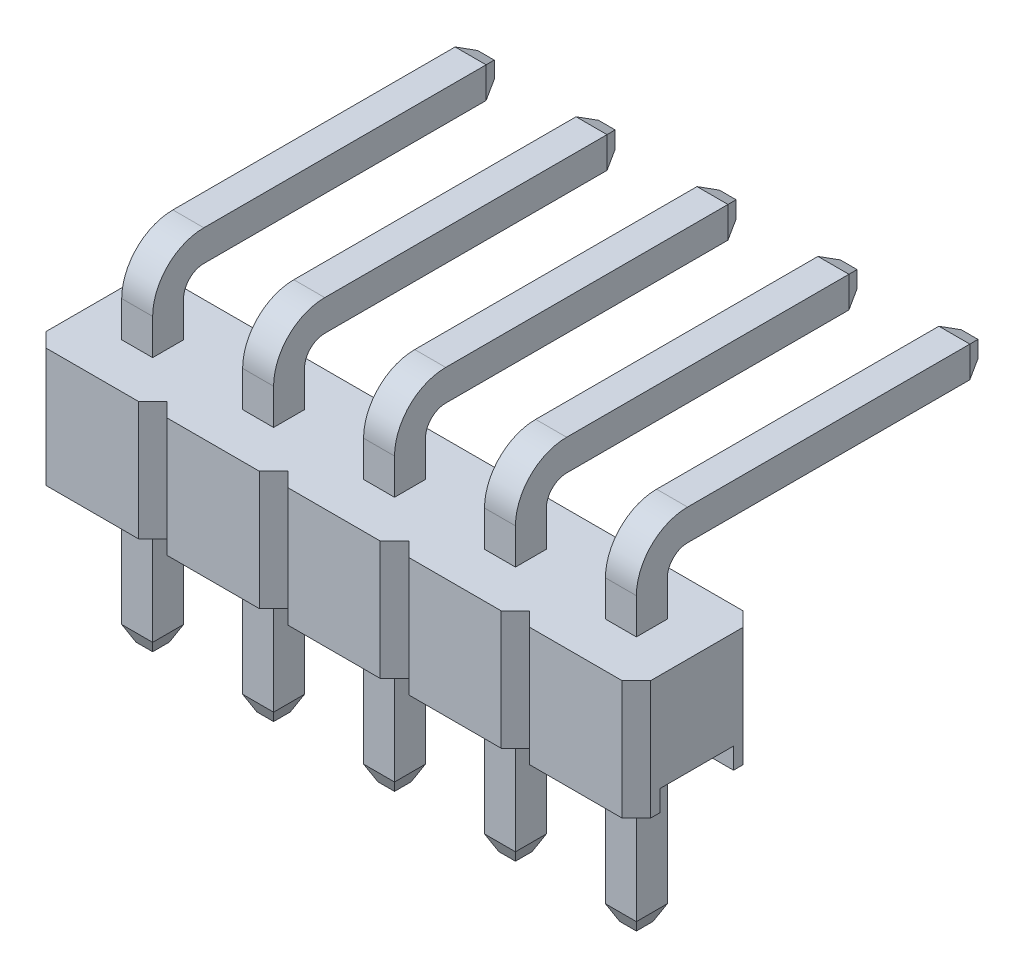
from build123d import *

# Parameters (mm, degrees)
BASE_DEPTH          = 2.5
BASE_PATTERN_COUNT  = 5
BASE_PATTERN_PITCH  = 2.54
CUT_DEPTH           = 12.768933682
CUT_DEPTH_BACK      = 12.768933682
SKETCH2_W           = 1.54
SKETCH2_H           = 0.44
SKETCH3_W           = 0.65
SKETCH3_H           = 0.65
PIN_CHAMFER_SIZE    = 0.15
PIN_CHAMFER_SIZE2   = 0.321676038
CHAMFER1_SIZE       = 0.15
CHAMFER1_SIZE2      = 0.321676038
PIN_START           = 2.215
PIN_PATTERN_DEPTH   = 0.65
PIN_START_2         = 4.755
PIN_PATTERN_2_DEPTH = 0.65
PIN_START_3         = 7.295
PIN_PATTERN_3_DEPTH = 0.65
PIN_START_4         = 9.835
PIN_PATTERN_4_DEPTH = 0.65
PIN_START_5         = -6.678323962
PIN_PATTERN_5_DEPTH = 7.678323962
PIN_START_6         = 2.5
PIN_PATTERN_6_DEPTH = 2.5


with BuildPart() as part:
    # Sketch1 → Base (new body)
    with BuildSketch(Plane(origin=(0, 0, 0), x_dir=(1, 0, 0), z_dir=(0, 1, 0))):
        Polygon((-1.27, 0.97), (-0.97, 1.27), (0.97, 1.27), (1.27, 0.97), (1.27, -0.97), (0.97, -1.27), (-0.97, -1.27), (-1.27, -0.97), align=None)
    base = extrude(amount=BASE_DEPTH)

    # Base_Pattern: Base ×5
    with Locations(*[(i * BASE_PATTERN_PITCH, 0, 0) for i in range(1, BASE_PATTERN_COUNT)]):
        add(base)

    # Sketch2 → Cut (cut, two sides: drawn at the far end of the back side and taken through both)
    with BuildSketch(Plane(origin=(0, 0, 0), x_dir=(0, 0, -1), z_dir=(1, 0, 0)).offset(-CUT_DEPTH_BACK)):
        with Locations((0, 0.22)):
            Rectangle(SKETCH2_W, SKETCH2_H)
    extrude(amount=CUT_DEPTH + CUT_DEPTH_BACK, mode=Mode.SUBTRACT)

    # Sweep1: sweep along a path in Sketch4
    with BuildLine(Plane(origin=(0, 0, 0), x_dir=(0, 0, -1), z_dir=(1, 0, 0))) as sweep1_path:
        Line((0, -3), (0, 3.25))
        ThreePointArc((0, 3.25), (0.219669914, 3.780330086), (0.75, 4))
        Line((0.75, 4), (7, 4))
    # Sketch3 → Sweep1 (sweep)
    with BuildSketch(Plane(origin=(0, -3, 0), x_dir=(1, 0, 0), z_dir=(0, 1, 0))):
        Rectangle(SKETCH3_W, SKETCH3_H)
    sweep(path=sweep1_path.line)

    # Pin Chamfer
    pin_chamfer_edges = [part.edges().sort_by_distance(p)[0] for p in [
        (0.325, -3, 0),
        (0, -3, -0.325),
        (-0.325, -3, 0),
        (0, -3, 0.325),
    ]]
    pin_chamfer_side = [part.faces().sort_by_distance(p)[0] for p in [
        (0, -3, 0),
    ]]
    chamfer(pin_chamfer_edges, length=PIN_CHAMFER_SIZE, length2=PIN_CHAMFER_SIZE2, reference=pin_chamfer_side[0])

    # Chamfer1
    chamfer1_edges = [part.edges().sort_by_distance(p)[0] for p in [
        (-0.325, 4, -7),
        (0, 4.325, -7),
        (0.325, 4, -7),
        (0, 3.675, -7),
    ]]
    chamfer1_side = [part.faces().sort_by_distance(p)[0] for p in [
        (0, 4, -7),
    ]]
    chamfer(chamfer1_edges, length=CHAMFER1_SIZE, length2=CHAMFER1_SIZE2, reference=chamfer1_side[0])

    # Pin Pattern: read off the stored shape, not the designer's step
    # Pin Pattern outline → Pin Pattern (add)
    with BuildSketch(Plane.YZ.offset(PIN_START)):
        Polygon((-2.678323962, 0.325), (-3, 0.175), (-3, -0.175), (-2.678323962, -0.325), (0.44, -0.325), (0.44, 0.325), align=None)
        with BuildLine():
            Line((2.5, -0.325), (3.25, -0.325))
            ThreePointArc((3.25, -0.325), (3.550520382, -0.449479618), (3.675, -0.75))
            Line((3.675, -0.75), (3.675, -6.678323962))
            Line((3.675, -6.678323962), (3.825, -7))
            Line((3.825, -7), (4.175, -7))
            Line((4.175, -7), (4.325, -6.678323962))
            Line((4.325, -6.678323962), (4.325, -0.75))
            ThreePointArc((4.325, -0.75), (4.01013979, 0.01013979), (3.25, 0.325))
            Line((3.25, 0.325), (2.5, 0.325))
            Line((2.5, 0.325), (2.5, -0.325))
        make_face()
    extrude(amount=PIN_PATTERN_DEPTH)

    # Pin Pattern 2 outline → Pin Pattern 2 (add)
    with BuildSketch(Plane.YZ.offset(PIN_START_2)):
        Polygon((-2.678323962, 0.325), (-3, 0.175), (-3, -0.175), (-2.678323962, -0.325), (0.44, -0.325), (0.44, 0.325), align=None)
        with BuildLine():
            Line((2.5, -0.325), (3.25, -0.325))
            ThreePointArc((3.25, -0.325), (3.550520382, -0.449479618), (3.675, -0.75))
            Line((3.675, -0.75), (3.675, -6.678323962))
            Line((3.675, -6.678323962), (3.825, -7))
            Line((3.825, -7), (4.175, -7))
            Line((4.175, -7), (4.325, -6.678323962))
            Line((4.325, -6.678323962), (4.325, -0.75))
            ThreePointArc((4.325, -0.75), (4.01013979, 0.01013979), (3.25, 0.325))
            Line((3.25, 0.325), (2.5, 0.325))
            Line((2.5, 0.325), (2.5, -0.325))
        make_face()
    extrude(amount=PIN_PATTERN_2_DEPTH)

    # Pin Pattern 3 outline → Pin Pattern 3 (add)
    with BuildSketch(Plane.YZ.offset(PIN_START_3)):
        Polygon((-2.678323962, 0.325), (-3, 0.175), (-3, -0.175), (-2.678323962, -0.325), (0.44, -0.325), (0.44, 0.325), align=None)
        with BuildLine():
            Line((2.5, -0.325), (3.25, -0.325))
            ThreePointArc((3.25, -0.325), (3.550520382, -0.449479618), (3.675, -0.75))
            Line((3.675, -0.75), (3.675, -6.678323962))
            Line((3.675, -6.678323962), (3.825, -7))
            Line((3.825, -7), (4.175, -7))
            Line((4.175, -7), (4.325, -6.678323962))
            Line((4.325, -6.678323962), (4.325, -0.75))
            ThreePointArc((4.325, -0.75), (4.01013979, 0.01013979), (3.25, 0.325))
            Line((3.25, 0.325), (2.5, 0.325))
            Line((2.5, 0.325), (2.5, -0.325))
        make_face()
    extrude(amount=PIN_PATTERN_3_DEPTH)

    # Pin Pattern 4 outline → Pin Pattern 4 (add)
    with BuildSketch(Plane.YZ.offset(PIN_START_4)):
        Polygon((-2.678323962, 0.325), (-3, 0.175), (-3, -0.175), (-2.678323962, -0.325), (0.44, -0.325), (0.44, 0.325), align=None)
        with BuildLine():
            Line((2.5, -0.325), (3.25, -0.325))
            ThreePointArc((3.25, -0.325), (3.550520382, -0.449479618), (3.675, -0.75))
            Line((3.675, -0.75), (3.675, -6.678323962))
            Line((3.675, -6.678323962), (3.825, -7))
            Line((3.825, -7), (4.175, -7))
            Line((4.175, -7), (4.325, -6.678323962))
            Line((4.325, -6.678323962), (4.325, -0.75))
            ThreePointArc((4.325, -0.75), (4.01013979, 0.01013979), (3.25, 0.325))
            Line((3.25, 0.325), (2.5, 0.325))
            Line((2.5, 0.325), (2.5, -0.325))
        make_face()
    extrude(amount=PIN_PATTERN_4_DEPTH)

    # Pin Pattern 5 outline → Pin Pattern 5 (cut)
    with BuildSketch(Plane.XY.offset(PIN_START_5)):
        Polygon((2.865, -2.678323962), (2.715, -3), (2.865, -3), align=None)
        Polygon((2.365, -3), (2.215, -2.678323962), (2.215, -3), align=None)
        Polygon((5.405, -2.678323962), (5.255, -3), (5.405, -3), align=None)
        Polygon((4.905, -3), (4.755, -2.678323962), (4.755, -3), align=None)
        Polygon((7.945, -2.678323962), (7.795, -3), (7.945, -3), align=None)
        Polygon((7.445, -3), (7.295, -2.678323962), (7.295, -3), align=None)
        Polygon((10.485, -2.678323962), (10.335, -3), (10.485, -3), align=None)
        Polygon((9.985, -3), (9.835, -2.678323962), (9.835, -3), align=None)
    extrude(amount=PIN_PATTERN_5_DEPTH, mode=Mode.SUBTRACT)

    # Pin Pattern 6 outline → Pin Pattern 6 (cut)
    with BuildSketch(Plane(origin=(0, 0, 0), x_dir=(1, 0, 0), z_dir=(0, 1, 0)).offset(PIN_START_6)):
        Polygon((2.865, 7), (2.715, 7), (2.865, 6.678323962), align=None)
        Polygon((2.215, 6.678323962), (2.365, 7), (2.215, 7), align=None)
        Polygon((5.405, 7), (5.255, 7), (5.405, 6.678323962), align=None)
        Polygon((4.755, 6.678323962), (4.905, 7), (4.755, 7), align=None)
        Polygon((7.945, 7), (7.795, 7), (7.945, 6.678323962), align=None)
        Polygon((7.295, 6.678323962), (7.445, 7), (7.295, 7), align=None)
        Polygon((10.485, 7), (10.335, 7), (10.485, 6.678323962), align=None)
        Polygon((9.835, 6.678323962), (9.985, 7), (9.835, 7), align=None)
    extrude(amount=PIN_PATTERN_6_DEPTH, mode=Mode.SUBTRACT)


solid = part.part
